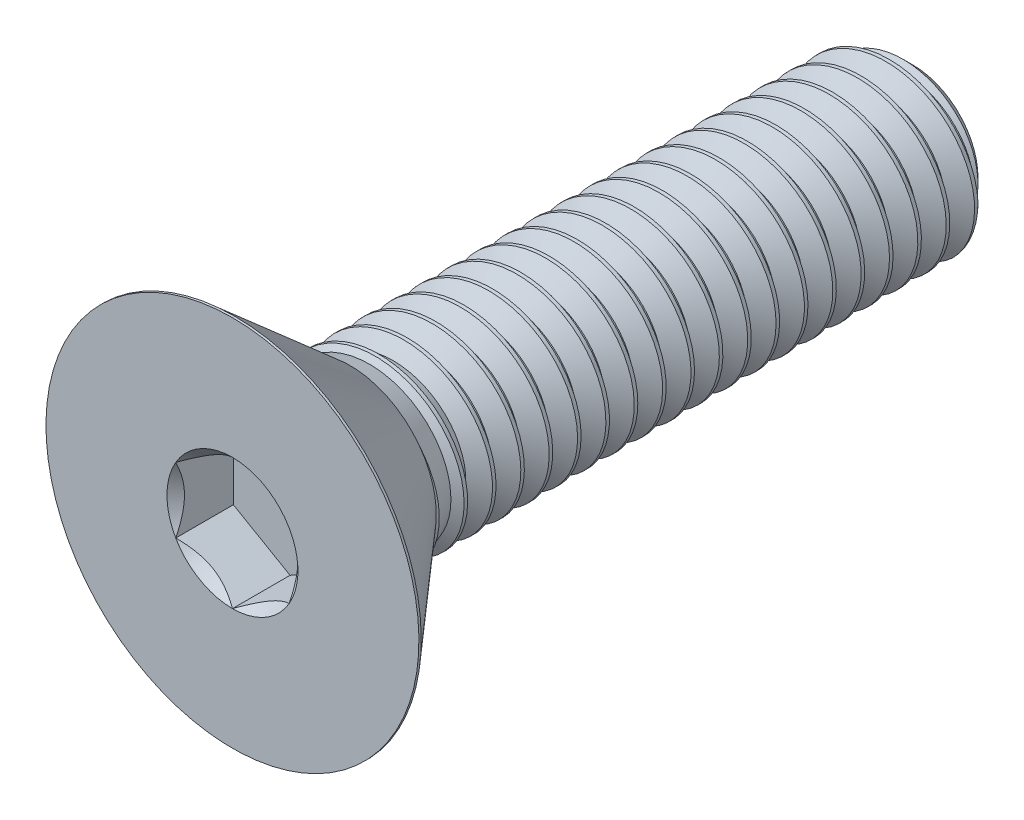
from build123d import *

# Parameters (mm, degrees)
SKETCH10_R         = 1.833087105
CUT_EXTRUDE2_DEPTH = 1.6129
CUT_EXTRUDE2_DRAFT = -45
CUT_EXTRUDE1_DEPTH = 1.6129
CUT_SWEEP1_PITCH   = 0.79375
CUT_SWEEP1_TO      = 15.756745


with BuildPart() as part:
    # Sketch2 → Revolve1 (revolve)
    with BuildSketch(Plane(origin=(0, 0, 0), x_dir=(0, 0, -1), z_dir=(1, 0, 0))):
        Polygon((-9.460484, 5.2197), (-6.231744991, 2.413), (8.9296875, 2.413), (9.525, 1.8176875), (9.525, 0), (-9.525, 0), (-9.525, 5.2197), align=None)
    revolve(axis=Axis((0, 0, -9.525), (0, 0, 1)))


with BuildPart() as cut_extrude2_tool:
    # Sketch10 → Cut-Extrude2 (with draft: the straight prism first)
    with BuildSketch(Plane.XY.offset(9.525)):
        Circle(SKETCH10_R)
    extrude(amount=-CUT_EXTRUDE2_DEPTH)
    # Cut-Extrude2: the draft: its side faces are tilted about the plane it starts from
    cut_extrude2_sides = [cut_extrude2_tool.faces().sort_by_distance(p)[0] for p in [
        (-1.833087105, 0, 8.71855),
    ]]
    draft(cut_extrude2_sides, Plane.XY.offset(9.525), CUT_EXTRUDE2_DRAFT)


with BuildPart() as part_1:
    add(part.part)

    # Cut-Extrude2: cut by cut_extrude2_tool
    add(cut_extrude2_tool.part, mode=Mode.SUBTRACT)

    # Sketch9 → Cut-Extrude1 (cut)
    with BuildSketch(Plane.XY.offset(9.525)):
        Polygon((1.5875, -0.916543552), (1.5875, 0.916543552), (0, 1.833087105), (-1.5875, 0.916543552), (-1.5875, -0.916543552), (0, -1.833087105), align=None)
    extrude(amount=-CUT_EXTRUDE1_DEPTH, mode=Mode.SUBTRACT)


with BuildPart() as body_2:
    # Split1: the piece on the far side of the plane
    add(part_1.part)
    split(bisect_by=Plane.XY.offset(6.231744991), keep=Keep.BOTTOM)

    # Cut-Sweep1: arcs per turn and ends read off the stored shape
    # Cut-Sweep1: the profile of Sketch4 screwed along a right-hand helix through 24 turns, 8 arcs to a turn; built about Z, then put on its axis
    cut_sweep1_z = Axis((0, 0, 0), (0, 0, 1))
    cut_sweep1_corners = [(2.455962979, 0, 0.024804688), (2.455962979, 0, -0.719335938), (1.897444252, 0, -0.396875), (1.897444252, 0, -0.29765625)]
    with BuildLine(mode=Mode.PRIVATE) as cut_sweep1_profile:
        Line(cut_sweep1_corners[0], cut_sweep1_corners[1])
        Line(cut_sweep1_corners[1], cut_sweep1_corners[2])
        Line(cut_sweep1_corners[2], cut_sweep1_corners[3])
        Line(cut_sweep1_corners[3], cut_sweep1_corners[0])
    cut_sweep1_cap = Face(cut_sweep1_profile.wire())
    cut_sweep1_turn_angles = [0, 22.5, 45, 67.5, 90, 112.5, 135, 157.5, 180, 202.5, 225, 247.5, 270, 292.5, 315, 337.5, 360]
    cut_sweep1_turn_weights = [1, 0.9238795325112867, 1, 0.9238795325112867, 1, 0.9238795325112867, 1, 0.9238795325112867, 1, 0.9238795325112867, 1, 0.9238795325112867, 1, 0.9238795325112867, 1, 0.9238795325112867, 1]
    cut_sweep1_turn_rails = [Edge.make_bspline([Vector(p[0], p[1], 0).rotate(cut_sweep1_z, cut_sweep1_turn_angles[k]) / cut_sweep1_turn_weights[k] + Vector(0, 0, p[2] + CUT_SWEEP1_PITCH * cut_sweep1_turn_angles[k] / 360) for k in range(17)], [0, 0, 0, 1, 1, 2, 2, 3, 3, 4, 4, 5, 5, 6, 6, 7, 7, 8, 8, 8], 2, cut_sweep1_turn_weights) for p in cut_sweep1_corners]
    cut_sweep1_turn_sides = [Face.make_surface_from_curves(cut_sweep1_turn_rails[p[0]], cut_sweep1_turn_rails[p[1]]) for p in [(0, 1), (1, 2), (2, 3), (3, 0)]]
    cut_sweep1 = Plane(origin=(0, 0, -9.525), x_dir=(0, 1, 0), z_dir=(0, 0, 1)) * split(Solid(Shell([*[p.moved(Location((0, 0, CUT_SWEEP1_PITCH * i))) for i in range(24) for p in cut_sweep1_turn_sides], cut_sweep1_cap, cut_sweep1_cap.rotate(cut_sweep1_z, 8640).moved(Location((0, 0, CUT_SWEEP1_PITCH * 8640 / 360)))])), bisect_by=Plane.XY.offset(CUT_SWEEP1_TO), keep=Keep.BOTTOM, mode=Mode.PRIVATE)
    add(cut_sweep1, mode=Mode.SUBTRACT)


with BuildPart() as part_2:
    add(part_1.part)

    # Split1
    split(bisect_by=Plane.XY.offset(6.231744991), keep=Keep.TOP)

    add(body_2.part)  # Boss-Extrude2 merges body 2
    # Boss-Extrude2 cone 1 section (through the dimple's axis) → Boss-Extrude2 (revolve)
    with BuildSketch(Plane(origin=(0, 0, 6.231744991), x_dir=(0, -1, 0), z_dir=(1, 0, 0))):
        Polygon((0, 0), (2.413, 0), (0, 6.629663013), align=None)
    revolve(axis=Axis((0, 0, 6.231744991), (0, 0, -1)))


solid = part_2.part
